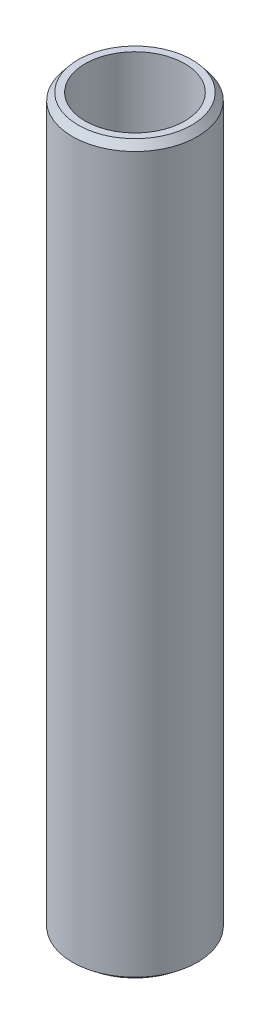
from build123d import *
from OCP.BRepFilletAPI import BRepFilletAPI_MakeChamfer

# Parameters (mm, degrees)
SKETCH1_R           = 22.5
BOSS_EXTRUDE1_DEPTH = 262.145483905
SKETCH2_R           = 17.925534603
CUT_EXTRUDE1_DEPTH  = 265.069602059
CHAMFER1_SIZE       = 2.565889098
CHAMFER1_SIZE2      = 2.054285947


with BuildPart() as part:
    # Sketch1 → Boss-Extrude1 (new body)
    with BuildSketch(Plane(origin=(0, 0, 0), x_dir=(1, 0, 0), z_dir=(0, 1, 0))):
        Circle(SKETCH1_R)
    extrude(amount=BOSS_EXTRUDE1_DEPTH)

    # Sketch2 → Cut-Extrude1 (cut, through all)
    with BuildSketch(Plane(origin=(0, 0, 0), x_dir=(1, 0, 0), z_dir=(0, 1, 0))):
        Circle(SKETCH2_R)
    extrude(amount=CUT_EXTRUDE1_DEPTH, mode=Mode.SUBTRACT)

    # Chamfer1: one chamfer whose edges measure the first distance from different faces: ONE call of the kernel's chamfer builder (chamfer() names one face for all edges)
    chamfer1_edges_1 = [part.edges().sort_by_distance(p)[0] for p in [
        (-22.5, 262.145483905, 0),
    ]]
    chamfer1_side_1 = [part.faces().sort_by_distance(p)[0] for p in [
        (-22.5, 131.072741952, 0),
    ]]
    chamfer1_edges_2 = [part.edges().sort_by_distance(p)[0] for p in [
        (-22.5, 0, 0),
    ]]
    chamfer1_side_2 = [part.faces().sort_by_distance(p)[0] for p in [
        (-21.863603897, 0, 0),
    ]]
    chamfer1 = BRepFilletAPI_MakeChamfer(part.part.solid().wrapped)
    for e in chamfer1_edges_1:
        chamfer1.Add(CHAMFER1_SIZE, CHAMFER1_SIZE2, e.wrapped, chamfer1_side_1[0].wrapped)  # the first distance lies on this face
    for e in chamfer1_edges_2:
        chamfer1.Add(CHAMFER1_SIZE, CHAMFER1_SIZE2, e.wrapped, chamfer1_side_2[0].wrapped)  # the first distance lies on this face
    add(Compound.cast(chamfer1.Shape()), mode=Mode.REPLACE)


solid = part.part
